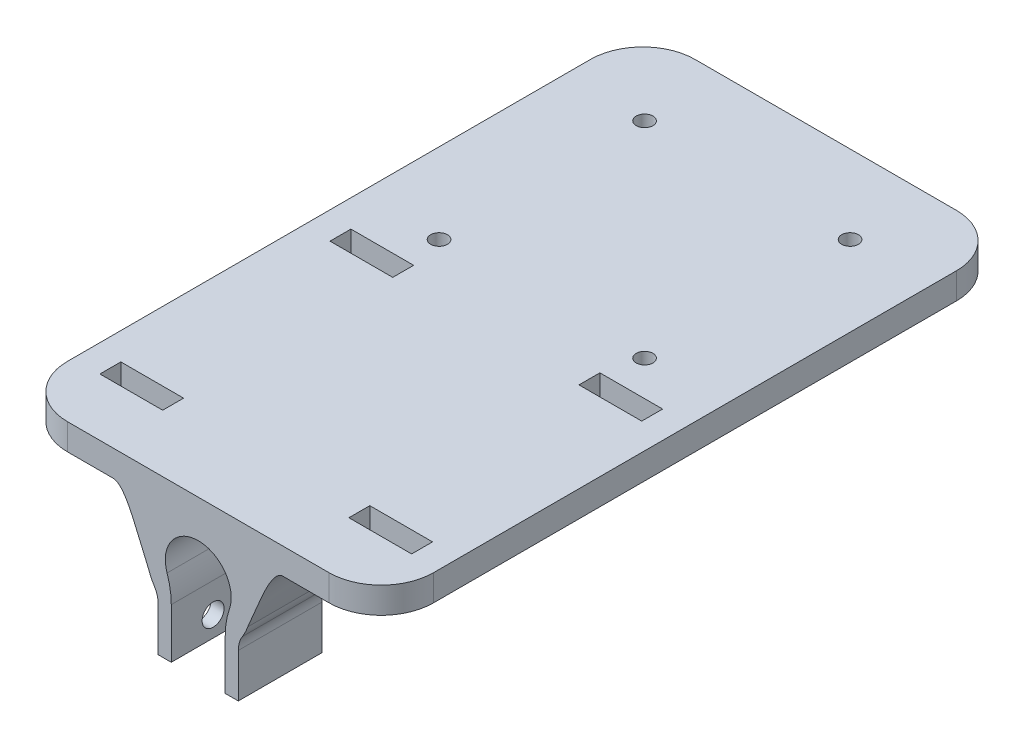
from build123d import *

# Parameters (mm, degrees)
BOSS_EXTRUDE2_START = 10
SKETCH3_W           = 70
SKETCH3_H           = 5
BOSS_EXTRUDE2_DEPTH = 120
BOSS_EXTRUDE3_START = 18
BOSS_EXTRUDE3_DEPTH = 8
SKETCH4_R           = 2.1
CUT_EXTRUDE1_DEPTH  = 11
FILLET1_R           = 10
SKETCH5_R           = 1.6
CUT_EXTRUDE2_DEPTH  = 11
CUT_EXTRUDE6_REACH  = 139.915
SKETCH6_W           = 12
SKETCH6_H           = 4


with BuildPart() as part:
    # Sketch3 → Boss-Extrude2 (new body)
    with BuildSketch(Plane.XY.offset(BOSS_EXTRUDE2_START)):
        with Locations((0, 11)):
            Rectangle(SKETCH3_W, SKETCH3_H)
    extrude(amount=BOSS_EXTRUDE2_DEPTH)

    # Sketch1 → Boss-Extrude3 (add, symmetric)
    with BuildSketch(Plane.XY.offset(BOSS_EXTRUDE3_START)):
        with BuildLine():
            Line((-16.09791322, 8.5), (16.09791322, 8.5))
            add(Edge.make_bspline(
                [(16.09791322, 8.5), (13.72529418, 8.152861079), (11.639302192, 1.566643295), (9.452357254, -3.263884549)],
                knots=[0, 0, 0, 0, 1, 1, 1, 1], degree=3))
            ThreePointArc((9.452357254, -3.263884549), (9.007679938, -4.343006118), (8.440296287, -5.362965465))
            ThreePointArc((8.440296287, -5.362965465), (7.859364307, -6.648156809), (7.660444431, -8.044448198))
            Line((7.660444431, -8.044448198), (7.660444431, -16.427876097))
            Line((7.660444431, -16.427876097), (6.160444431, -16.427876097))
            Line((6.160444431, -16.427876097), (5.160444431, -16.427876097))
            Line((5.160444431, -16.427876097), (5.160444431, -6.87360752))
            ThreePointArc((5.160444431, -6.87360752), (5.362430355, -4.42028744), (5.962948353, -2.033038844))
            ThreePointArc((5.962948353, -2.033038844), (0, 6.3), (-5.962948353, -2.033038844))
            ThreePointArc((-5.962948353, -2.033038844), (-5.362430355, -4.42028744), (-5.160444431, -6.87360752))
            Line((-5.160444431, -6.87360752), (-5.160444431, -16.427876097))
            Line((-5.160444431, -16.427876097), (-6.160444431, -16.427876097))
            Line((-6.160444431, -16.427876097), (-7.660444431, -16.427876097))
            Line((-7.660444431, -16.427876097), (-7.660444431, -8.044448198))
            ThreePointArc((-7.660444431, -8.044448198), (-7.859364307, -6.648156809), (-8.440296287, -5.362965465))
            ThreePointArc((-8.440296287, -5.362965465), (-9.007679938, -4.343006118), (-9.452357254, -3.263884549))
            add(Edge.make_bspline(
                [(-16.09791322, 8.5), (-13.72529418, 8.152861079), (-11.639302192, 1.566643295), (-9.452357254, -3.263884549)],
                knots=[0, 0, 0, 0, 1, 1, 1, 1], degree=3))
        make_face()
    boss_extrude3 = extrude(amount=BOSS_EXTRUDE3_DEPTH, both=True)

    # Sketch4 → Cut-Extrude1 (cut)
    with BuildSketch(Plane.ZY.offset(7.660444431)):
        with Locations((18, -12.521824291)):
            Circle(SKETCH4_R)
    cut_extrude1 = extrude(amount=-CUT_EXTRUDE1_DEPTH, mode=Mode.SUBTRACT)

    # Mirror2: Boss-Extrude3, Cut-Extrude1 across plane
    add(boss_extrude3.mirror(Plane.XY.offset(70)))
    add(cut_extrude1.mirror(Plane.XY.offset(70)), mode=Mode.SUBTRACT)

    # Fillet1
    fillet1_edges = [part.edges().sort_by_distance(p)[0] for p in [
        (35, 11, 10),
        (35, 11, 130),
        (-35, 11, 130),
        (-35, 11, 10),
    ]]
    fillet(fillet1_edges, radius=FILLET1_R)

    # Sketch5 → Cut-Extrude2 (cut)
    with BuildSketch(Plane(origin=(0, 13.5, 0), x_dir=(1, 0, 0), z_dir=(0, 1, 0))):
        with Locations((19.65, -25)):
            Circle(SKETCH5_R)
        with Locations((19.65, -64.3)):
            Circle(SKETCH5_R)
        with Locations((-19.65, -64.3)):
            Circle(SKETCH5_R)
        with Locations((-19.65, -25)):
            Circle(SKETCH5_R)
    extrude(amount=-CUT_EXTRUDE2_DEPTH, mode=Mode.SUBTRACT)

    # Sketch6 → Cut-Extrude6 (cut, up to next)
    with BuildSketch(Plane(origin=(0, 13.5, 0), x_dir=(1, 0, 0), z_dir=(0, 1, 0)), mode=Mode.PRIVATE) as cut_extrude6_sk1:
        with Locations((-23.806344776, -73)):
            Rectangle(SKETCH6_W, SKETCH6_H)
    cut_extrude6_tool1 = extrude(cut_extrude6_sk1.sketch, amount=-CUT_EXTRUDE6_REACH, mode=Mode.PRIVATE) & part.part
    # Sketch6 → Cut-Extrude6 (cut, up to next)
    with BuildSketch(Plane(origin=(0, 13.5, 0), x_dir=(1, 0, 0), z_dir=(0, 1, 0)), mode=Mode.PRIVATE) as cut_extrude6_sk2:
        with Locations((-23.806344776, -117)):
            Rectangle(SKETCH6_W, SKETCH6_H)
    cut_extrude6_tool2 = extrude(cut_extrude6_sk2.sketch, amount=-CUT_EXTRUDE6_REACH, mode=Mode.PRIVATE) & part.part
    # Sketch6 → Cut-Extrude6 (cut, up to next)
    with BuildSketch(Plane(origin=(0, 13.5, 0), x_dir=(1, 0, 0), z_dir=(0, 1, 0)), mode=Mode.PRIVATE) as cut_extrude6_sk3:
        with Locations((23.806344776, -73)):
            Rectangle(SKETCH6_W, SKETCH6_H)
    cut_extrude6_tool3 = extrude(cut_extrude6_sk3.sketch, amount=-CUT_EXTRUDE6_REACH, mode=Mode.PRIVATE) & part.part
    # Sketch6 → Cut-Extrude6 (cut, up to next)
    with BuildSketch(Plane(origin=(0, 13.5, 0), x_dir=(1, 0, 0), z_dir=(0, 1, 0)), mode=Mode.PRIVATE) as cut_extrude6_sk4:
        with Locations((23.806344776, -117)):
            Rectangle(SKETCH6_W, SKETCH6_H)
    cut_extrude6_tool4 = extrude(cut_extrude6_sk4.sketch, amount=-CUT_EXTRUDE6_REACH, mode=Mode.PRIVATE) & part.part
    add(cut_extrude6_tool1.solids().sort_by_distance((-23.806345, 13.5, 73))[0], mode=Mode.SUBTRACT)
    add(cut_extrude6_tool2.solids().sort_by_distance((-23.806345, 13.5, 117))[0], mode=Mode.SUBTRACT)
    add(cut_extrude6_tool3.solids().sort_by_distance((23.806345, 13.5, 73))[0], mode=Mode.SUBTRACT)
    add(cut_extrude6_tool4.solids().sort_by_distance((23.806345, 13.5, 117))[0], mode=Mode.SUBTRACT)


solid = part.part
